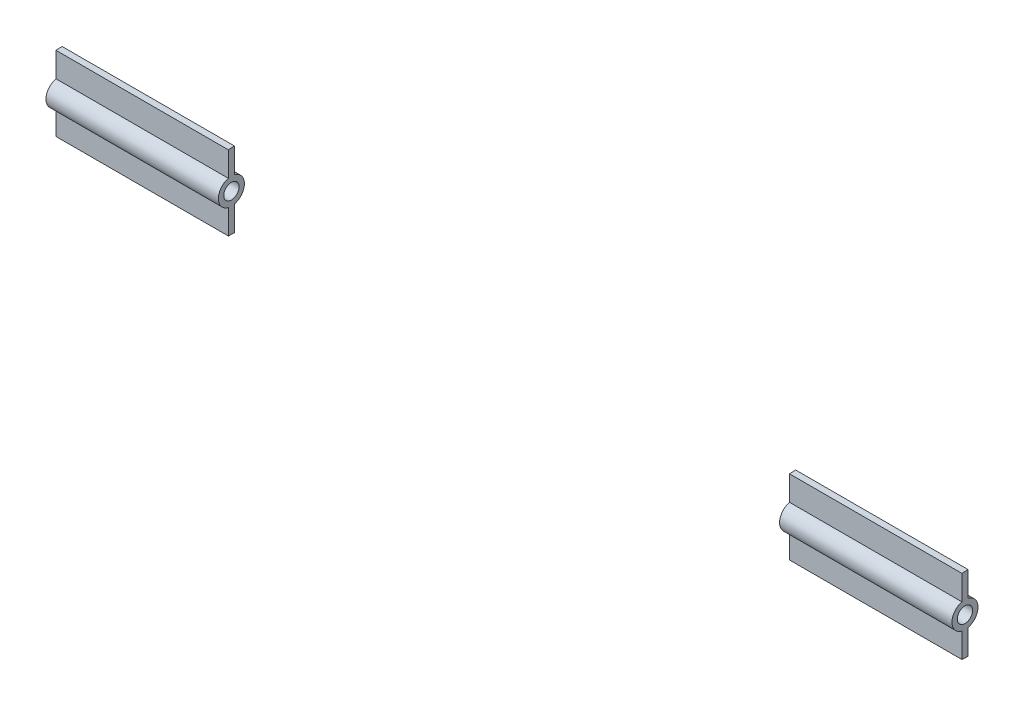
from build123d import *

# Parameters (mm, degrees)
SKETCH3_3_R         = 2
BOSS_EXTRUDE2_DEPTH = 45
BOSS_EXTRUDE3_START = -45
SKETCH4_3_R         = 2
BOSS_EXTRUDE3_DEPTH = 45


with BuildPart() as part:
    # Sketch3<3> → Boss-Extrude2 (new body)
    with BuildSketch(Plane.ZY.offset(-236.5)):
        with BuildLine():
            Line((117.799963298, 9.743799031), (116.199963298, 9.811394623))
            Line((116.199963298, 9.811394623), (116.199963298, 3.304542328))
            ThreePointArc((116.199963298, 3.304542328), (113.599963298, 0), (116.199963298, -3.304542328))
            Line((116.199963298, -3.304542328), (116.199963298, -9.811394623))
            Line((116.199963298, -9.811394623), (117.799963298, -9.743799031))
            Line((117.799963298, -9.743799031), (117.799963298, -3.304542328))
            ThreePointArc((117.799963298, -3.304542328), (120.399963298, 0), (117.799963298, 3.304542328))
            Line((117.799963298, 3.304542328), (117.799963298, 9.743799031))
        make_face()
        with Locations((116.999963298, 0)):
            Circle(SKETCH3_3_R, mode=Mode.SUBTRACT)
    extrude(amount=-BOSS_EXTRUDE2_DEPTH)


with BuildPart() as body_2:
    # Sketch4<3> → Boss-Extrude3 (new body)
    with BuildSketch(Plane(origin=(473, 0, 0), x_dir=(0, 0, -1), z_dir=(1, 0, 0)).offset(BOSS_EXTRUDE3_START)):
        with BuildLine():
            Line((-116.199963298, 9.811394623), (-117.799963298, 9.743799031))
            Line((-117.799963298, 9.743799031), (-117.799963298, 3.304542328))
            ThreePointArc((-117.799963298, 3.304542328), (-120.399963298, 0), (-117.799963298, -3.304542328))
            Line((-117.799963298, -3.304542328), (-117.799963298, -9.743799031))
            Line((-117.799963298, -9.743799031), (-116.199963298, -9.811394623))
            Line((-116.199963298, -9.811394623), (-116.199963298, -3.304542328))
            ThreePointArc((-116.199963298, -3.304542328), (-113.599963298, 0), (-116.199963298, 3.304542328))
            Line((-116.199963298, 3.304542328), (-116.199963298, 9.811394623))
        make_face()
        with Locations((-116.999963298, 0)):
            Circle(SKETCH4_3_R, mode=Mode.SUBTRACT)
    extrude(amount=BOSS_EXTRUDE3_DEPTH)


solid = Compound([part.part, body_2.part])
